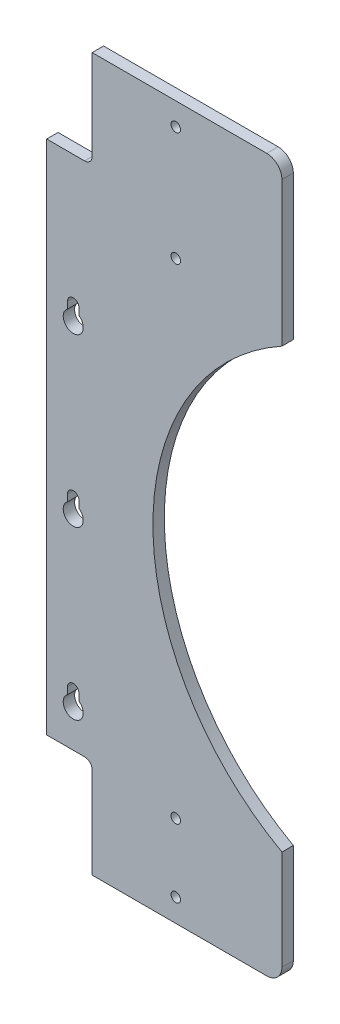
from build123d import *

# Parameters (mm, degrees)
BOSS_EXTRUDE1_DEPTH            = 9.525
V_0_377_DIAMETER_SLOT2_DEPTH   = 9.525
CUT_EXTRUDE1_REACH             = 358.93
SKETCH6_W                      = 152.4
SKETCH6_H                      = 622.3
FILLET1_R                      = 12.7
SKETCH7_R                      = 8.382
CUT_EXTRUDE2_DEPTH             = 357.929879318
SKETCH12_W                     = 38.1
SKETCH12_H                     = 107.95
SKETCH12_H_2                   = 82.55
CUT_EXTRUDE3_DEPTH             = 357.929879318
FILLET2_R                      = 6.35
F_5_16_0_3125_DIAMETER_HOLE1_D = 7.9375
SKETCH16_W                     = 158.75
SKETCH16_H                     = 26.277954941
CUT_EXTRUDE4_DEPTH             = 357.929879318
F_5_16_0_3125_DIAMETER_HOLE2_D = 7.9375
FILLET3_R                      = 12.7
CUT_EXTRUDE5_DEPTH             = 1.27


# Read off the part's stored shape, not the designer's step: V (0.377) Diameter Slot2
with BuildPart() as part:
    # Sketch1 → Boss-Extrude1 (new body)
    with BuildSketch(Plane.XY):
        with BuildLine():
            Line((-174.625, 151.522045059), (-174.625, 311.15))
            Line((-174.625, 311.15), (174.625, 311.15))
            Line((174.625, 311.15), (174.625, 151.522045059))
            ThreePointArc((174.625, 151.522045059), (66.675, -31.75), (174.625, -215.022045059))
            Line((174.625, -215.022045059), (174.625, -311.15))
            Line((174.625, -311.15), (-174.625, -311.15))
            Line((-174.625, -311.15), (-174.625, -215.022045059))
            ThreePointArc((-174.625, -215.022045059), (-66.675, -31.75), (-174.625, 151.522045059))
        make_face()
    extrude(amount=BOSS_EXTRUDE1_DEPTH)

    # V (0.377) Diameter Slot2 outline → V (0.377) Diameter Slot2 (cut)
    with BuildSketch(Plane.XY):
        with BuildLine():
            Line((4.7879, -57.8866), (4.7879, -45.2374))
            ThreePointArc((4.7879, -45.2374), (0, -40.4495), (-4.7879, -45.2374))
            Line((-4.7879, -45.2374), (-4.7879, -57.8866))
            ThreePointArc((-4.7879, -57.8866), (0, -62.6745), (4.7879, -57.8866))
        make_face()
        with BuildLine():
            ThreePointArc((4.7879, 94.4626), (0, 99.2505), (-4.7879, 94.4626))
            Line((-4.7879, 94.4626), (-4.7879, 81.8134))
            ThreePointArc((-4.7879, 81.8134), (0, 77.0255), (4.7879, 81.8134))
            Line((4.7879, 81.8134), (4.7879, 94.4626))
        make_face()
        with BuildLine():
            ThreePointArc((4.7879, -184.9374), (0, -180.1495), (-4.7879, -184.9374))
            Line((-4.7879, -184.9374), (-4.7879, -197.5866))
            ThreePointArc((-4.7879, -197.5866), (0, -202.3745), (4.7879, -197.5866))
            Line((4.7879, -197.5866), (4.7879, -184.9374))
        make_face()
    extrude(amount=V_0_377_DIAMETER_SLOT2_DEPTH, mode=Mode.SUBTRACT)

    # Sketch6 → Cut-Extrude1 (cut, up to next)
    with BuildSketch(Plane.XY.offset(9.525), mode=Mode.PRIVATE) as cut_extrude1_sk1:
        with Locations((-98.425, 0)):
            Rectangle(SKETCH6_W, SKETCH6_H)
    cut_extrude1_tool1 = extrude(cut_extrude1_sk1.sketch, amount=-CUT_EXTRUDE1_REACH, mode=Mode.PRIVATE) & part.part
    add(cut_extrude1_tool1.solids().sort_by_distance((-98.425, 0, 9.525))[0], mode=Mode.SUBTRACT)

    # Fillet1
    fillet1_edges = [part.edges().sort_by_distance(p)[0] for p in [
        (174.625, -311.15, 4.7625),
    ]]
    fillet(fillet1_edges, radius=FILLET1_R)

    # Sketch7 → Cut-Extrude2 (cut, through all)
    with BuildSketch(Plane.XY.offset(9.525)):
        with Locations((0, -197.5866)):
            Circle(SKETCH7_R)
        with Locations((0, 81.8134)):
            Circle(SKETCH7_R)
        with Locations((0, -57.8866)):
            Circle(SKETCH7_R)
    extrude(amount=-CUT_EXTRUDE2_DEPTH, mode=Mode.SUBTRACT)

    # Sketch12 → Cut-Extrude3 (cut, through all)
    with BuildSketch(Plane.XY.offset(9.525)):
        with Locations((-3.175, 257.175)):
            Rectangle(SKETCH12_W, SKETCH12_H)
        with Locations((-3.175, -269.875)):
            Rectangle(SKETCH12_W, SKETCH12_H_2)
    extrude(amount=-CUT_EXTRUDE3_DEPTH, mode=Mode.SUBTRACT)

    # Fillet2
    fillet2_edges = [part.edges().sort_by_distance(p)[0] for p in [
        (15.875, 203.2, 4.7625),
        (15.875, -228.6, 4.7625),
    ]]
    fillet(fillet2_edges, radius=FILLET2_R)

    # 5/16 (0.3125) Diameter Hole1 (through all)
    with Locations(Plane.XY.offset(9.525)):
        with Locations((85.7885, 170.688), (85.7885, 265.938)):
            Hole(F_5_16_0_3125_DIAMETER_HOLE1_D / 2)

    # Sketch16 → Cut-Extrude4 (cut, through all)
    with BuildSketch(Plane.XY.offset(9.525)):
        with Locations((95.25, 298.011022529)):
            Rectangle(SKETCH16_W, SKETCH16_H)
    extrude(amount=-CUT_EXTRUDE4_DEPTH, mode=Mode.SUBTRACT)

    # 5/16 (0.3125) Diameter Hole2 (through all)
    with Locations(Plane.XY.offset(9.525)):
        with Locations((85.7885, -234.95), (85.7885, -292.1)):
            Hole(F_5_16_0_3125_DIAMETER_HOLE2_D / 2)

    # Fillet3
    fillet3_edges = [part.edges().sort_by_distance(p)[0] for p in [
        (174.625, 284.872045059, 4.7625),
    ]]
    fillet(fillet3_edges, radius=FILLET3_R)

    # Sketch22 → Cut-Extrude5 (cut)
    with BuildSketch(Plane(origin=(0, 0, 0), x_dir=(-1, 0, 0), z_dir=(0, 0, -1))):
        with BuildLine():
            Line((4.803205128, 190.5), (7.344731571, 190.5))
            add(Edge.make_bspline(
                [(7.344731571, 190.5), (7.514335094, 190.499435445), (7.839992647, 190.498351437), (8.306529942, 190.492307098), (8.730445408, 190.474983007), (9.111517396, 190.460074718), (9.449738916, 190.432889674), (9.746147085, 190.406906754), (9.99937673, 190.372893757), (10.152668819, 190.341305508), (10.222075321, 190.327003205)],
                knots=[0, 0, 0, 0, 1.410062039, 2.707475311, 3.878576406, 4.937260626, 5.877586885, 6.699081471, 7.410979367, 8, 8, 8, 8], degree=3))
            add(Edge.make_bspline(
                [(10.222075321, 190.327003205), (10.314990785, 190.304046085), (10.498839576, 190.258621583), (10.763544101, 190.162611031), (11.015781791, 190.051505536), (11.254504868, 189.921008608), (11.478517596, 189.77015155), (11.690129752, 189.601538649), (11.890301576, 189.416092502), (12.070937777, 189.209137506), (12.241259479, 188.992016457), (12.384909638, 188.757234253), (12.508740007, 188.511719568), (12.607330169, 188.252975509), (12.686715958, 187.983511365), (12.74269117, 187.700886303), (12.776259765, 187.406387908), (12.779677355, 187.205517781), (12.781410256, 187.103665865)],
                knots=[0, 0, 0, 0, 1.027469482, 2.033020251, 3.019912614, 3.986113645, 4.951240523, 5.91722682, 6.890402269, 7.87763091, 8.8651537, 9.85103654, 10.82876324, 11.815024772, 12.821070561, 13.842952187, 14.906261191, 16, 16, 16, 16], degree=3))
            add(Edge.make_bspline(
                [(12.781410256, 187.103665865), (12.776079892, 186.934447057), (12.76567897, 186.604257334), (12.668705022, 186.125064993), (12.509858794, 185.678063765), (12.290971431, 185.263816479), (12.012226476, 184.890397852), (11.677219377, 184.562409628), (11.285763244, 184.287944802), (10.921348297, 184.097616054), (10.599442487, 183.975721785), (10.334435895, 183.889955569), (10.045358576, 183.823690724), (9.734980248, 183.764326817), (9.40200927, 183.719507811), (9.047243698, 183.686681597), (8.670430519, 183.666165478), (8.41157161, 183.663110203), (8.278405449, 183.661538462)],
                knots=[0, 0, 0, 0, 1.260483769, 2.459530307, 3.627416485, 4.787058657, 5.939039949, 7.08810263, 8.267026773, 9.491475466, 10.141966685, 10.831826277, 11.566392101, 12.351337768, 13.187381173, 14.07005841, 15.007169909, 16, 16, 16, 16], degree=3))
            Line((8.278405449, 183.661538462), (12.944230769, 177.8))
            Line((12.944230769, 177.8), (11.534815705, 177.8))
            Line((11.534815705, 177.8), (6.868990385, 183.661538462))
            Line((6.868990385, 183.661538462), (5.942948718, 183.661538462))
            Line((5.942948718, 183.661538462), (5.942948718, 177.8))
            Line((5.942948718, 177.8), (4.803205128, 177.8))
            Line((4.803205128, 177.8), (4.803205128, 190.5))
        make_face()
        with BuildLine():
            Line((5.942948718, 189.197435897), (5.942948718, 184.964102564))
            Line((5.942948718, 184.964102564), (8.268229167, 184.946294071))
            add(Edge.make_bspline(
                [(8.268229167, 184.946294071), (8.376796165, 184.94624604), (8.587229929, 184.946152944), (8.891669485, 184.960644647), (9.17513389, 184.977130401), (9.436538905, 185.002346598), (9.676001307, 185.034844344), (9.893401406, 185.075495173), (10.08909408, 185.122855514), (10.31732592, 185.196158556), (10.572184191, 185.31229468), (10.849158345, 185.481260918), (11.085023971, 185.69378315), (11.284297357, 185.936801119), (11.444424151, 186.203995508), (11.557316462, 186.492163476), (11.628953324, 186.794030132), (11.637402618, 187.00150498), (11.641666667, 187.106209936)],
                knots=[0, 0, 0, 0, 1.146690395, 2.22261258, 3.21895312, 4.145990853, 4.996080663, 5.770904154, 6.481378293, 7.121626537, 8.300444488, 9.431385265, 10.535395872, 11.636531494, 12.74115979, 13.810798291, 14.895190096, 16, 16, 16, 16], degree=3))
            add(Edge.make_bspline(
                [(11.641666667, 187.106209936), (11.637304684, 187.208341789), (11.628660827, 187.410729855), (11.558089581, 187.707024158), (11.438748112, 187.986667092), (11.277921706, 188.24852108), (11.081981915, 188.486213322), (10.852228709, 188.68958442), (10.594944144, 188.857403906), (10.354474367, 188.964644087), (10.139538796, 189.030393268), (9.952922601, 189.076661777), (9.742060953, 189.113834564), (9.505930003, 189.143618099), (9.2455378, 189.169217469), (8.959567723, 189.186459637), (8.649917121, 189.196669944), (8.435298256, 189.197174638), (8.324198718, 189.197435897)],
                knots=[0, 0, 0, 0, 1.101028733, 2.181837193, 3.264309656, 4.369019818, 5.486613113, 6.575447106, 7.666700264, 8.788928104, 9.402425223, 10.0903467, 10.862060571, 11.710948788, 12.657782767, 13.684531032, 14.801375019, 16, 16, 16, 16], degree=3))
            Line((8.324198718, 189.197435897), (5.942948718, 189.197435897))
        make_face(mode=Mode.SUBTRACT)
    extrude(amount=-CUT_EXTRUDE5_DEPTH, mode=Mode.SUBTRACT)


solid = part.part
